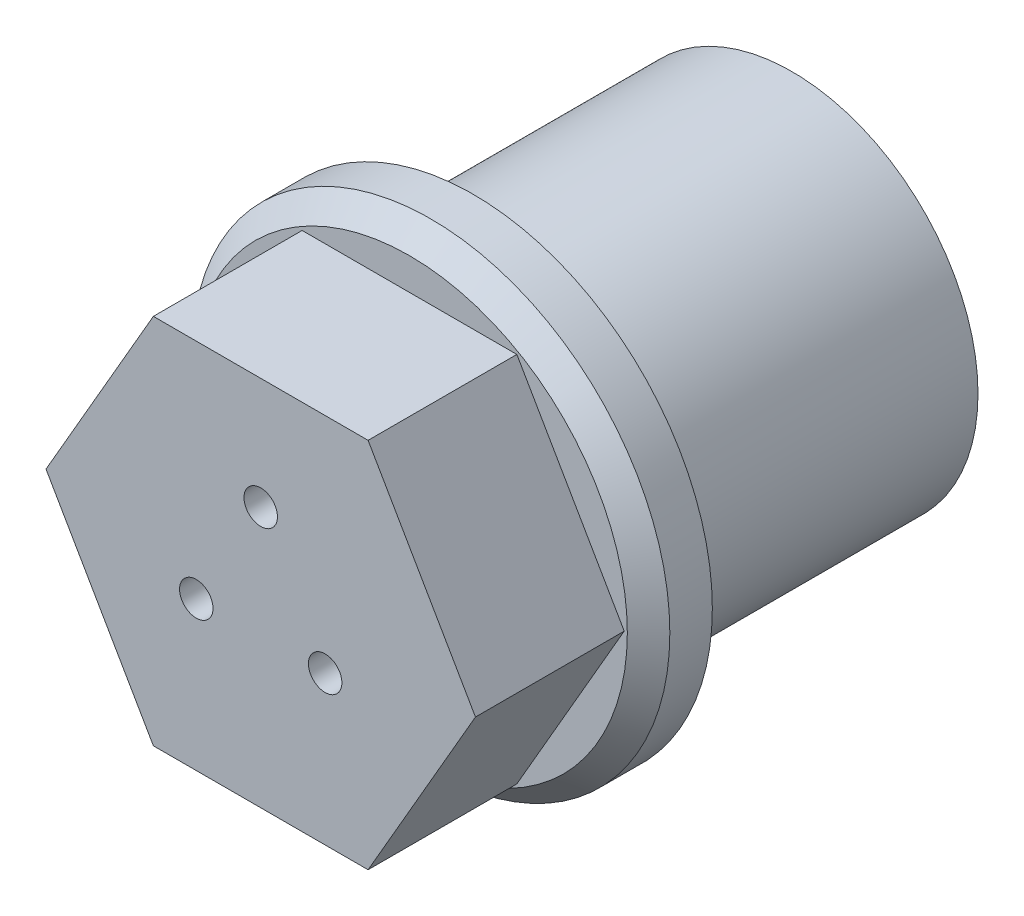
from build123d import *

# Parameters (mm, degrees)
SKETCH1_R           = 11.1125
BOSS_EXTRUDE1_DEPTH = 19.05
SKETCH2_R           = 14.2875
BOSS_EXTRUDE2_DEPTH = 12.7
CUT_EXTRUDE1_START  = -8.89
SKETCH3_R           = 14.2875
CUT_EXTRUDE1_DEPTH  = 8.89
CHAMFER1_SIZE       = 1.27
CUT_EXTRUDE2_REACH  = 39.634
SKETCH4_R           = 1


with BuildPart() as part:
    # Sketch1 → Boss-Extrude1 (new body)
    with BuildSketch(Plane.XY):
        with Locations(Location((0, 0, 0), (0, 0, 180))):
            Circle(SKETCH1_R)
    extrude(amount=BOSS_EXTRUDE1_DEPTH)

    # Sketch2 → Boss-Extrude2 (add)
    with BuildSketch(Plane.XY.offset(19.05)):
        Circle(SKETCH2_R)
    extrude(amount=BOSS_EXTRUDE2_DEPTH)

    # Sketch3 → Cut-Extrude1 (cut)
    with BuildSketch(Plane.XY.offset(31.75).offset(CUT_EXTRUDE1_START)):
        Circle(SKETCH3_R)
        Polygon((12.831609733, 0), (6.415804866, 11.1125), (-6.415804866, 11.1125), (-12.831609733, 0), (-6.415804866, -11.1125), (6.415804866, -11.1125), align=None, mode=Mode.SUBTRACT)
    extrude(amount=CUT_EXTRUDE1_DEPTH, mode=Mode.SUBTRACT)

    # Chamfer1
    chamfer1_edges = [part.edges().sort_by_distance(p)[0] for p in [
        (-14.2875, 0, 22.86),
    ]]
    chamfer(chamfer1_edges, length=CHAMFER1_SIZE)

    # Cut-Loft1: read off the stored shape, not the designer's step
    # Cut-Loft1: loft between two sections, ruled curve by curve
    cut_loft1_from = [
        Edge.make_bspline([(2.35183174, 9.256296648, 0), (-16.160761555, 13.959960127, 0), (-20.864425035, -4.552633168, 0), (-2.35183174, -9.256296648, 0), (16.160761555, -13.959960127, 0), (20.864425035, 4.552633168, 0), (2.35183174, 9.256296648, 0)], [0, 0, 0, 0, 0.5, 0.5, 0.5, 1, 1, 1, 1], 3, [1, 0.333333333, 0.333333333, 1, 0.333333333, 0.333333333, 1]),
    ]
    cut_loft1_to = [
        Edge.make_bspline([(2.644109425, 4.759906548, 22.86), (-6.875703672, 10.048125398, 22.86), (-12.163922522, 0.528312301, 22.86), (-2.644109425, -4.759906548, 22.86), (6.875703672, -10.048125398, 22.86), (12.163922522, -0.528312301, 22.86), (2.644109425, 4.759906548, 22.86)], [0, 0, 0, 0, 0.5, 0.5, 0.5, 1, 1, 1, 1], 3, [1, 0.333333333, 0.333333333, 1, 0.333333333, 0.333333333, 1]),
    ]
    cut_loft1 = Solid(Shell([*[Face.make_surface_from_curves(cut_loft1_from[k], cut_loft1_to[k]) for k in range(1)], Face(Wire(cut_loft1_from)), Face(Wire(cut_loft1_to))]))
    add(cut_loft1, mode=Mode.SUBTRACT)

    # Sketch4 → Cut-Extrude2 (cut, up to next)
    with BuildSketch(Plane.XY.offset(31.75), mode=Mode.PRIVATE) as cut_extrude2_sk1:
        with Locations((0, 4.445)):
            Circle(SKETCH4_R)
    cut_extrude2_tool1 = extrude(cut_extrude2_sk1.sketch, amount=-CUT_EXTRUDE2_REACH, mode=Mode.PRIVATE) & part.part
    # Sketch4 → Cut-Extrude2 (cut, up to next)
    with BuildSketch(Plane.XY.offset(31.75), mode=Mode.PRIVATE) as cut_extrude2_sk2:
        with Locations((3.84948292, -2.2225)):
            Circle(SKETCH4_R)
    cut_extrude2_tool2 = extrude(cut_extrude2_sk2.sketch, amount=-CUT_EXTRUDE2_REACH, mode=Mode.PRIVATE) & part.part
    # Sketch4 → Cut-Extrude2 (cut, up to next)
    with BuildSketch(Plane.XY.offset(31.75), mode=Mode.PRIVATE) as cut_extrude2_sk3:
        with Locations((-3.84948292, -2.2225)):
            Circle(SKETCH4_R)
    cut_extrude2_tool3 = extrude(cut_extrude2_sk3.sketch, amount=-CUT_EXTRUDE2_REACH, mode=Mode.PRIVATE) & part.part
    add(cut_extrude2_tool1.solids().sort_by_distance((0, 4.445, 31.75))[0], mode=Mode.SUBTRACT)
    add(cut_extrude2_tool2.solids().sort_by_distance((3.849483, -2.2225, 31.75))[0], mode=Mode.SUBTRACT)
    add(cut_extrude2_tool3.solids().sort_by_distance((-3.849483, -2.2225, 31.75))[0], mode=Mode.SUBTRACT)


solid = part.part
